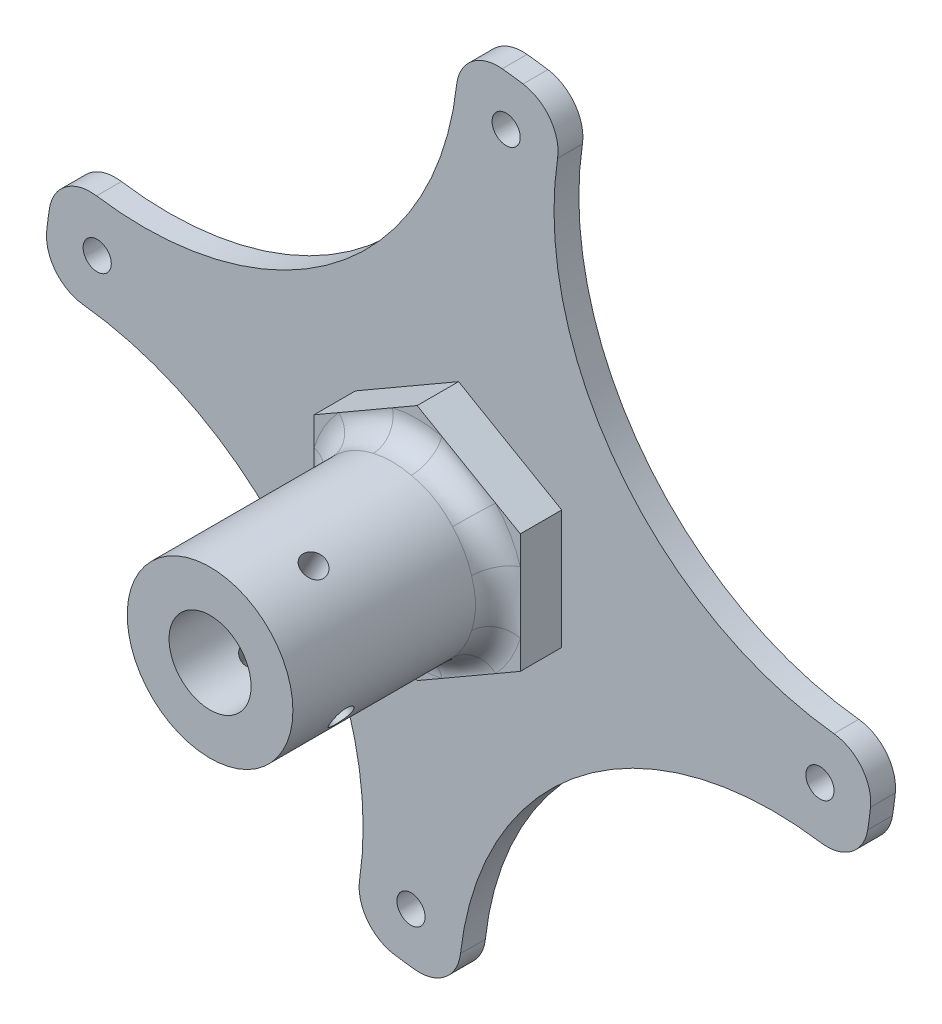
from build123d import *

# Parameters (mm, degrees)
SKETCH1_R                           = 50
BOSS_EXTRUDE1_DEPTH                 = 3
BOSS_EXTRUDE2_DEPTH                 = 5
SKETCH3_R                           = 10
BOSS_EXTRUDE3_DEPTH                 = 25
FILLET1_R                           = 3
SKETCH4_R                           = 4.95
CUT_EXTRUDE1_DEPTH                  = 79.0320447
F_1_0MM_DOWEL_HOLE1_D               = 2.8
F_1_0MM_DOWEL_HOLE1_DEPTH           = 33.158795133
F_1_0MM_DOWEL_HOLE1_TIP             = 0.841204867
F_1_0MM_DOWEL_HOLE1_ON_FACE_2_D     = 2.8
F_1_0MM_DOWEL_HOLE1_ON_FACE_2_DEPTH = 33.158795133
F_1_0MM_DOWEL_HOLE1_ON_FACE_2_TIP   = 0.841204867
CUT_EXTRUDE2_START                  = -25
CUT_EXTRUDE2_DEPTH                  = 25
FILLET2_R                           = 5
F_1_0MM_DOWEL_HOLE2_D               = 3.4
F_1_0MM_DOWEL_HOLE2_DEPTH           = 32.978536948
F_1_0MM_DOWEL_HOLE2_TIP             = 1.021463052


with BuildPart() as part:
    # Sketch1 → Boss-Extrude1 (new body)
    with BuildSketch(Plane.XY):
        Circle(SKETCH1_R)
    extrude(amount=BOSS_EXTRUDE1_DEPTH)

    # Sketch2 → Boss-Extrude2 (add)
    with BuildSketch(Plane.XY.offset(3)):
        Polygon((12.45, -7.188010851), (12.45, 7.188010851), (0, 14.376021703), (-12.45, 7.188010851), (-12.45, -7.188010851), (0, -14.376021703), align=None)
    extrude(amount=BOSS_EXTRUDE2_DEPTH)

    # Sketch3 → Boss-Extrude3 (add)
    with BuildSketch(Plane.XY.offset(8)):
        Circle(SKETCH3_R)
    extrude(amount=BOSS_EXTRUDE3_DEPTH)

    # Fillet1
    fillet1_edges = [part.edges().sort_by_distance(p)[0] for p in [
        (-10, 0, 8),
    ]]
    fillet(fillet1_edges, radius=FILLET1_R)

    # Sketch4 → Cut-Extrude1 (cut, through all)
    with BuildSketch(Plane.XY.offset(33)):
        Circle(SKETCH4_R)
    extrude(amount=-CUT_EXTRUDE1_DEPTH, mode=Mode.SUBTRACT)

    # Ø1.0mm Dowel Hole1
    with Locations(Plane(origin=(-8.696036674, 4.937504042, 25.857386746), x_dir=(-0.493750404175, -0.869603667413, 0), z_dir=(-0.869603667413, 0.493750404175, 0))):
        with Locations((0, 0)):
            Hole(F_1_0MM_DOWEL_HOLE1_D / 2, depth=F_1_0MM_DOWEL_HOLE1_DEPTH)
            with Locations((0, 0, -(F_1_0MM_DOWEL_HOLE1_DEPTH + F_1_0MM_DOWEL_HOLE1_TIP / 2))):  # 118° drill point
                Cone(0, F_1_0MM_DOWEL_HOLE1_D / 2, F_1_0MM_DOWEL_HOLE1_TIP, mode=Mode.SUBTRACT)

    # Ø1.0mm Dowel Hole1 on face 2
    with Locations(Plane(origin=(4.844249125, 8.748328435, 25.328642637), x_dir=(0.87483284318, -0.484424913163, 0), z_dir=(0.484424913163, 0.87483284318, 0))):
        with Locations((0, 0)):
            Hole(F_1_0MM_DOWEL_HOLE1_ON_FACE_2_D / 2, depth=F_1_0MM_DOWEL_HOLE1_ON_FACE_2_DEPTH)
            with Locations((0, 0, -(F_1_0MM_DOWEL_HOLE1_ON_FACE_2_DEPTH + F_1_0MM_DOWEL_HOLE1_ON_FACE_2_TIP / 2))):  # 118° drill point
                Cone(0, F_1_0MM_DOWEL_HOLE1_ON_FACE_2_D / 2, F_1_0MM_DOWEL_HOLE1_ON_FACE_2_TIP, mode=Mode.SUBTRACT)

    # Sketch6 → Cut-Extrude2 (cut)
    with BuildSketch(Plane.XY.offset(3).offset(CUT_EXTRUDE2_START)):
        with BuildLine():
            Line((-49.037179863, 0), (-50, 0))
            ThreePointArc((-50, 0), (-39.667667015, -30.43807145), (-12.940952255, -48.296291314))
            ThreePointArc((-12.940952255, -48.296291314), (-19.080518481, -15.247800886), (-49.037179863, 0))
        make_face()
        with BuildLine():
            ThreePointArc((0, 50), (-30.43807145, 39.667667015), (-48.296291314, 12.940952255))
            Line((-48.296291314, 12.940952255), (-47.366278478, 12.691756067))
            ThreePointArc((-47.366278478, 12.691756067), (-14.483944315, 19.666646244), (0, 50))
        make_face()
        with BuildLine():
            ThreePointArc((48.296291314, -12.940952255), (14.864016159, -19.371163), (0, -50))
            ThreePointArc((0, -50), (30.43807145, -39.667667015), (48.296291314, -12.940952255))
        make_face()
        with BuildLine():
            ThreePointArc((50, 0), (39.667667015, 30.43807145), (12.940952255, 48.296291314))
            ThreePointArc((12.940952255, 48.296291314), (19.371163, 14.864016159), (50, 0))
        make_face()
    extrude(amount=CUT_EXTRUDE2_DEPTH, mode=Mode.SUBTRACT)

    # Fillet2
    fillet2_edges = [part.edges().sort_by_distance(p)[0] for p in [
        (-48.296291314, 12.940952255, 1.5),
        (-50, 0, 1.5),
        (-12.940952255, -48.296291314, 1.5),
        (0, -50, 1.5),
        (48.296291314, -12.940952255, 1.5),
        (50, 0, 1.5),
        (0, 50, 1.5),
        (12.940952255, 48.296291314, 1.5),
    ]]
    fillet(fillet2_edges, radius=FILLET2_R)

    # Ø1.0mm Dowel Hole2
    with Locations(Plane(origin=(5.743152458, 43.6235739, 0), x_dir=(-1, 0, 0), z_dir=(0, 0, -1))):
        with Locations((0, 0), (49.366726358, -37.880421442), (11.486304916, -87.2471478), (-37.880421442, -49.366726358)):
            Hole(F_1_0MM_DOWEL_HOLE2_D / 2, depth=F_1_0MM_DOWEL_HOLE2_DEPTH)
            with Locations((0, 0, -(F_1_0MM_DOWEL_HOLE2_DEPTH + F_1_0MM_DOWEL_HOLE2_TIP / 2))):  # 118° drill point
                Cone(0, F_1_0MM_DOWEL_HOLE2_D / 2, F_1_0MM_DOWEL_HOLE2_TIP, mode=Mode.SUBTRACT)


solid = part.part
